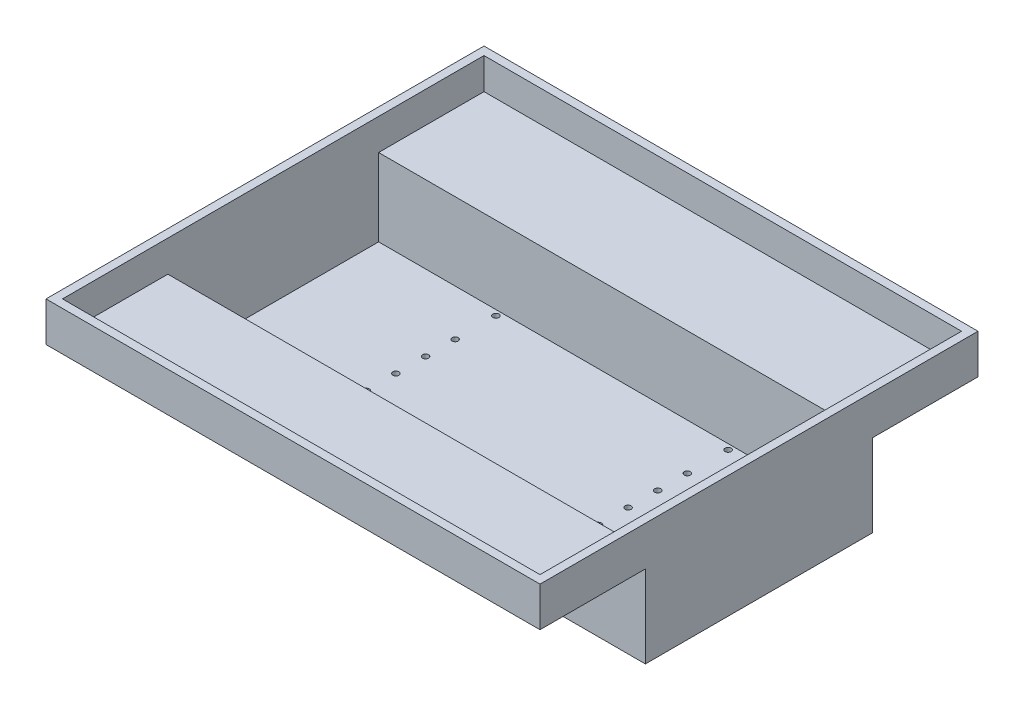
from build123d import *

# Parameters (mm, degrees)
BOSS_EXTRUDE1_DEPTH = 150
SHELL1_START        = -42
SHELL1_OUTLINE_W    = 290
SHELL1_OUTLINE_H    = 128
SHELL1_DEPTH        = 61
SHELL1_START_2      = 5
SHELL1_2_OUTLINE_W  = 290
SHELL1_2_OUTLINE_H  = 64
SHELL1_2_DEPTH      = 14
SKETCH2_R           = 1.85
CUT_EXTRUDE2_DEPTH  = 207.613165118
SKETCH3_W           = 290
SKETCH3_H           = 256
CUT_EXTRUDE3_DEPTH  = 5


# Read off the part's stored shape, not the designer's step: Shell1
with BuildPart() as part:
    # Sketch1 → Boss-Extrude1 (new, symmetric)
    with BuildSketch(Plane(origin=(0, 0, 0), x_dir=(0, 0, -1), z_dir=(1, 0, 0))):
        Polygon((-69, 0), (-133, 0), (-133, 24), (133, 24), (133, 0), (69, 0), (69, -50), (-69, -50), align=None)
    extrude(amount=BOSS_EXTRUDE1_DEPTH, both=True)

    # Shell1 outline → Shell1 (cut)
    with BuildSketch(Plane(origin=(0, 0, 0), x_dir=(1, 0, 0), z_dir=(0, 1, 0)).offset(SHELL1_START)):
        Rectangle(SHELL1_OUTLINE_W, SHELL1_OUTLINE_H)
    extrude(amount=SHELL1_DEPTH, mode=Mode.SUBTRACT)

    # Shell1 2 outline → Shell1 2 (cut)
    with BuildSketch(Plane(origin=(0, 0, 0), x_dir=(1, 0, 0), z_dir=(0, 1, 0)).offset(SHELL1_START_2)):
        with Locations((0, 96)):
            Rectangle(SHELL1_2_OUTLINE_W, SHELL1_2_OUTLINE_H)
        with Locations((0, -96)):
            Rectangle(SHELL1_2_OUTLINE_W, SHELL1_2_OUTLINE_H)
    extrude(amount=SHELL1_2_DEPTH, mode=Mode.SUBTRACT)

    # Sketch2 → Cut-Extrude2 (cut, through all)
    with BuildSketch(Plane(origin=(0, 0, 0), x_dir=(1, 0, 0), z_dir=(0, 1, 0))):
        with Locations(Location((70.5, 0, 0), (0, 0, 270))):
            Circle(SKETCH2_R)
        with Locations(Location((70.5, 18, 0), (0, 0, 270))):
            Circle(SKETCH2_R)
        with Locations(Location((70.5, 36, 0), (0, 0, 270))):
            Circle(SKETCH2_R)
        with Locations(Location((70.5, -18, 0), (0, 0, 270))):
            Circle(SKETCH2_R)
        with Locations(Location((70.5, -36, 0), (0, 0, 270))):
            Circle(SKETCH2_R)
        with Locations(Location((70.5, -60.75, 0), (0, 0, 270))):
            Circle(SKETCH2_R)
        with Locations(Location((70.5, 60.75, 0), (0, 0, 270))):
            Circle(SKETCH2_R)
        with Locations(Location((-70.5, -60.75, 0), (0, 0, 270))):
            Circle(SKETCH2_R)
        with Locations(Location((-70.5, -36, 0), (0, 0, 270))):
            Circle(SKETCH2_R)
        with Locations(Location((-70.5, -18, 0), (0, 0, 270))):
            Circle(SKETCH2_R)
        with Locations(Location((-70.5, 0, 0), (0, 0, 270))):
            Circle(SKETCH2_R)
        with Locations(Location((-70.5, 18, 0), (0, 0, 270))):
            Circle(SKETCH2_R)
        with Locations(Location((-70.5, 36, 0), (0, 0, 270))):
            Circle(SKETCH2_R)
        with Locations(Location((-70.5, 60.75, 0), (0, 0, 270))):
            Circle(SKETCH2_R)
    extrude(amount=-CUT_EXTRUDE2_DEPTH, mode=Mode.SUBTRACT)

    # Sketch3 → Cut-Extrude3 (cut)
    with BuildSketch(Plane(origin=(0, 24, 0), x_dir=(1, 0, 0), z_dir=(0, 1, 0))):
        Rectangle(SKETCH3_W, SKETCH3_H)
    extrude(amount=-CUT_EXTRUDE3_DEPTH, mode=Mode.SUBTRACT)


solid = part.part
